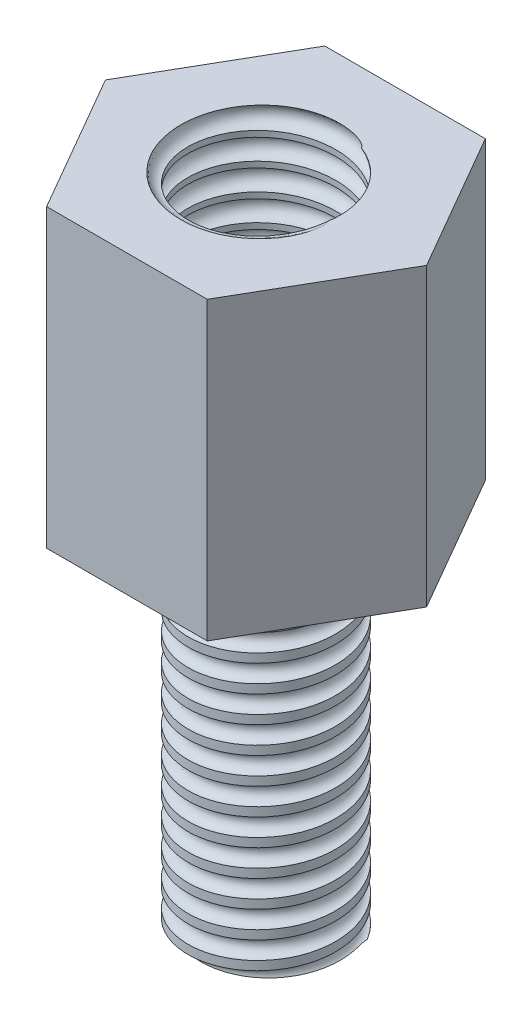
from build123d import *

# Parameters (mm, degrees)
BOSS_EXTRUDE1_DEPTH = 8
SKETCH2_R           = 1.25
BOSS_EXTRUDE2_DEPTH = 6
CUT_SWEEP3_PITCH    = 0.45
SKETCH9_R           = 1.25
CUT_EXTRUDE1_DEPTH  = 6
CUT_SWEEP4_PITCH    = 0.45
SKETCH12_W          = 6.920256496
SKETCH12_H          = 6.039496578
CUT_EXTRUDE2_DEPTH  = 3


with BuildPart() as part:
    # Sketch1 → Boss-Extrude1 (new body)
    with BuildSketch(Plane(origin=(0, 0, 0), x_dir=(1, 0, 0), z_dir=(0, 1, 0))):
        Polygon((1.356773133, -2.35), (2.713546265, 0), (1.356773133, 2.35), (-1.356773133, 2.35), (-2.713546265, 0), (-1.356773133, -2.35), align=None)
    extrude(amount=BOSS_EXTRUDE1_DEPTH)

    # Sketch2 → Boss-Extrude2 (add)
    with BuildSketch(Plane.XZ):
        with Locations(Location((0, 0, 0), (0, 0, 270))):
            Circle(SKETCH2_R)
    extrude(amount=BOSS_EXTRUDE2_DEPTH)

    # Cut-Sweep3: arcs per turn and ends read off the stored shape
    # Cut-Sweep3: the profile of Sketch5 screwed along a right-hand helix through 14.25 turns, 6 arcs to a turn; built about Z, then put on its axis
    cut_sweep3_z = Axis((0, 0, 0), (0, 0, 1))
    cut_sweep3_corners = [(1.1, 0, -0.45), (1.25, 0, -0.3), (1.4, 0, -0.45), (1.25, 0, -0.6)]
    with BuildLine(mode=Mode.PRIVATE) as cut_sweep3_profile:
        ThreePointArc((1.1, 0, -0.45), (1.143933983, 0, -0.343933983), (1.25, 0, -0.3))
        ThreePointArc((1.25, 0, -0.3), (1.356066017, 0, -0.343933983), (1.4, 0, -0.45))
        ThreePointArc((1.4, 0, -0.45), (1.356066017, 0, -0.556066017), (1.25, 0, -0.6))
        ThreePointArc((1.25, 0, -0.6), (1.143933983, 0, -0.556066017), (1.1, 0, -0.45))
    cut_sweep3_cap = Face(cut_sweep3_profile.wire())
    cut_sweep3_arcs = [((1.1, 0, -0.45), (1.1, 0, -0.3), (1.25, 0, -0.3), (1, 0.7071067811865476, 1)), ((1.25, 0, -0.3), (1.4, 0, -0.3), (1.4, 0, -0.45), (1, 0.7071067811865476, 1)), ((1.4, 0, -0.45), (1.4, 0, -0.6), (1.25, 0, -0.6), (1, 0.7071067811865476, 1)), ((1.25, 0, -0.6), (1.1, 0, -0.6), (1.1, 0, -0.45), (1, 0.7071067811865476, 1))]  # start, shoulder, end, weights
    cut_sweep3_turn_angles = [0, 30, 60, 90, 120, 150, 180, 210, 240, 270, 300, 330, 360]
    cut_sweep3_turn_weights = [1, 0.8660254037844387, 1, 0.8660254037844387, 1, 0.8660254037844387, 1, 0.8660254037844387, 1, 0.8660254037844387, 1, 0.8660254037844387, 1]
    cut_sweep3_turn_sides = [Face.make_bezier_surface([[Vector(p[j][0], p[j][1], 0).rotate(cut_sweep3_z, cut_sweep3_turn_angles[2 * i + k]) / cut_sweep3_turn_weights[2 * i + k] + Vector(0, 0, p[j][2] + CUT_SWEEP3_PITCH * cut_sweep3_turn_angles[2 * i + k] / 360) for k in range(3)] for j in range(3)], [[p[3][j] * cut_sweep3_turn_weights[2 * i + k] for k in range(3)] for j in range(3)]) for p in cut_sweep3_arcs for i in range(6)]
    cut_sweep3_last_angles = [5040, 5070, 5100, 5115, 5130]
    cut_sweep3_last_weights = [1, 0.8660254037844387, 1, 0.9659258262890683, 1]
    cut_sweep3_last_sides = [Face.make_bezier_surface([[Vector(p[j][0], p[j][1], 0).rotate(cut_sweep3_z, cut_sweep3_last_angles[2 * i + k]) / cut_sweep3_last_weights[2 * i + k] + Vector(0, 0, p[j][2] + CUT_SWEEP3_PITCH * cut_sweep3_last_angles[2 * i + k] / 360) for k in range(3)] for j in range(3)], [[p[3][j] * cut_sweep3_last_weights[2 * i + k] for k in range(3)] for j in range(3)]) for p in cut_sweep3_arcs for i in range(2)]
    cut_sweep3 = Plane(origin=(0, -6, 0), x_dir=(0, 0, 1), z_dir=(0, 1, 0)) * Solid(Shell([*[p.moved(Location((0, 0, CUT_SWEEP3_PITCH * i))) for i in range(14) for p in cut_sweep3_turn_sides], *cut_sweep3_last_sides, cut_sweep3_cap, cut_sweep3_cap.rotate(cut_sweep3_z, 5130).moved(Location((0, 0, CUT_SWEEP3_PITCH * 5130 / 360)))]))
    add(cut_sweep3, mode=Mode.SUBTRACT)

    # Sketch9 → Cut-Extrude1 (cut)
    with BuildSketch(Plane(origin=(0, 8, 0), x_dir=(1, 0, 0), z_dir=(0, 1, 0))):
        with Locations(Location((0, 0, 0), (0, 0, 270))):
            Circle(SKETCH9_R)
    extrude(amount=-CUT_EXTRUDE1_DEPTH, mode=Mode.SUBTRACT)

    # Cut-Sweep4: arcs per turn and ends read off the stored shape
    # Cut-Sweep4: the profile of Sketch11 screwed along a right-hand helix through 14.25 turns, 6 arcs to a turn; built about Z, then put on its axis
    cut_sweep4_z = Axis((0, 0, 0), (0, 0, 1))
    cut_sweep4_corners = [(1.425, 0, -0.45), (1.25, 0, -0.625), (1.075, 0, -0.45), (1.25, 0, -0.275)]
    with BuildLine(mode=Mode.PRIVATE) as cut_sweep4_profile:
        ThreePointArc((1.425, 0, -0.45), (1.373743687, 0, -0.573743687), (1.25, 0, -0.625))
        ThreePointArc((1.25, 0, -0.625), (1.126256313, 0, -0.573743687), (1.075, 0, -0.45))
        ThreePointArc((1.075, 0, -0.45), (1.126256313, 0, -0.326256313), (1.25, 0, -0.275))
        ThreePointArc((1.25, 0, -0.275), (1.373743687, 0, -0.326256313), (1.425, 0, -0.45))
    cut_sweep4_cap = Face(cut_sweep4_profile.wire())
    cut_sweep4_arcs = [((1.425, 0, -0.45), (1.425, 0, -0.625), (1.25, 0, -0.625), (1, 0.7071067811865476, 1)), ((1.25, 0, -0.625), (1.075, 0, -0.625), (1.075, 0, -0.45), (1, 0.7071067811865476, 1)), ((1.075, 0, -0.45), (1.075, 0, -0.275), (1.25, 0, -0.275), (1, 0.7071067811865476, 1)), ((1.25, 0, -0.275), (1.425, 0, -0.275), (1.425, 0, -0.45), (1, 0.7071067811865476, 1))]  # start, shoulder, end, weights
    cut_sweep4_turn_angles = [0, 30, 60, 90, 120, 150, 180, 210, 240, 270, 300, 330, 360]
    cut_sweep4_turn_weights = [1, 0.8660254037844387, 1, 0.8660254037844387, 1, 0.8660254037844387, 1, 0.8660254037844387, 1, 0.8660254037844387, 1, 0.8660254037844387, 1]
    cut_sweep4_turn_sides = [Face.make_bezier_surface([[Vector(p[j][0], p[j][1], 0).rotate(cut_sweep4_z, cut_sweep4_turn_angles[2 * i + k]) / cut_sweep4_turn_weights[2 * i + k] + Vector(0, 0, p[j][2] + CUT_SWEEP4_PITCH * cut_sweep4_turn_angles[2 * i + k] / 360) for k in range(3)] for j in range(3)], [[p[3][j] * cut_sweep4_turn_weights[2 * i + k] for k in range(3)] for j in range(3)]) for p in cut_sweep4_arcs for i in range(6)]
    cut_sweep4_last_angles = [5040, 5070, 5100, 5115, 5130]
    cut_sweep4_last_weights = [1, 0.8660254037844387, 1, 0.9659258262890683, 1]
    cut_sweep4_last_sides = [Face.make_bezier_surface([[Vector(p[j][0], p[j][1], 0).rotate(cut_sweep4_z, cut_sweep4_last_angles[2 * i + k]) / cut_sweep4_last_weights[2 * i + k] + Vector(0, 0, p[j][2] + CUT_SWEEP4_PITCH * cut_sweep4_last_angles[2 * i + k] / 360) for k in range(3)] for j in range(3)], [[p[3][j] * cut_sweep4_last_weights[2 * i + k] for k in range(3)] for j in range(3)]) for p in cut_sweep4_arcs for i in range(2)]
    cut_sweep4 = Plane(origin=(0, 8, 0), x_dir=(0, 0, -1), z_dir=(0, -1, 0)) * Solid(Shell([*[p.moved(Location((0, 0, CUT_SWEEP4_PITCH * i))) for i in range(14) for p in cut_sweep4_turn_sides], *cut_sweep4_last_sides, cut_sweep4_cap, cut_sweep4_cap.rotate(cut_sweep4_z, 5130).moved(Location((0, 0, CUT_SWEEP4_PITCH * 5130 / 360)))]))
    add(cut_sweep4, mode=Mode.SUBTRACT)

    # Sketch12 → Cut-Extrude2 (cut)
    with BuildSketch(Plane(origin=(0, 8, 0), x_dir=(1, 0, 0), z_dir=(0, 1, 0))):
        Rectangle(SKETCH12_W, SKETCH12_H)
    extrude(amount=-CUT_EXTRUDE2_DEPTH, mode=Mode.SUBTRACT)


solid = part.part
